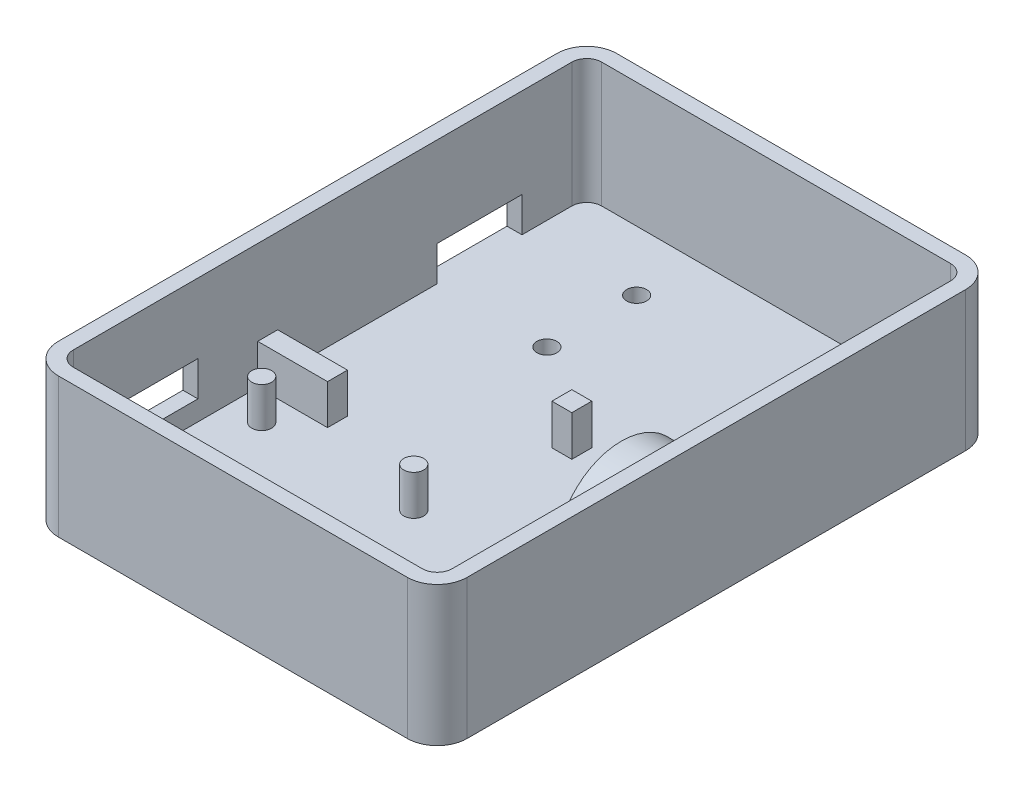
from build123d import *

# Parameters (mm, degrees)
SKETCH2_W            = 41
SKETCH2_H            = 56
BOSS_EXTRUDE1_DEPTH  = 14
FILLET1_R            = 3
SHELL1_T             = -1.5
SKETCH3_W            = 7
SKETCH3_H            = 2
SKETCH3_W_2          = 2
SKETCH3_H_2          = 5
BOSS_EXTRUDE3_DEPTH  = 4
SKETCH4_W            = 2
SKETCH4_H            = 2
BOSS_EXTRUDE4_DEPTH  = 4.052221169
SKETCH6_W            = 8
SKETCH6_H            = 3.5
CUT_EXTRUDE1_DEPTH   = 70.944620951
SKETCH7_R            = 1
BOSS_EXTRUDE5_DEPTH  = 4
SKETCH8_W            = 8.5
SKETCH8_H            = 3.5
CUT_EXTRUDE2_DEPTH   = 70.944620951
SKETCH12_R           = 6.5
BOSS_EXTRUDE7_DEPTH  = 3.5
SKETCH13_R           = 5.15
CUT_EXTRUDE5_DEPTH   = 3.5
SKETCH15_W           = 1.3
SKETCH15_H           = 3.704358433
BOSS_EXTRUDE8_DEPTH  = 3.5
SKETCH16_W           = 2.3
SKETCH16_H           = 1.398241718
BOSS_EXTRUDE9_DEPTH  = 3.5
SKETCH17_W           = 1.2
SKETCH17_H           = 5.421175269
BOSS_EXTRUDE10_DEPTH = 3.5
SKETCH18_W           = 2.4
SKETCH18_H           = 1.320829883
BOSS_EXTRUDE12_DEPTH = 3.5
SKETCH21_W           = 4
SKETCH21_H           = 3
CUT_EXTRUDE6_DEPTH   = 3.5
SKETCH22_R           = 1
CUT_EXTRUDE7_DEPTH   = 71.521273386
SKETCH28_R           = 1
CUT_EXTRUDE10_DEPTH  = 71.521273386


with BuildPart() as part:
    # Sketch2 → Boss-Extrude1 (new body)
    with BuildSketch(Plane(origin=(0, 0, 0), x_dir=(1, 0, 0), z_dir=(0, 1, 0))):
        with Locations((20.5, 28)):
            Rectangle(SKETCH2_W, SKETCH2_H)
    extrude(amount=BOSS_EXTRUDE1_DEPTH)

    # Fillet1
    fillet1_edges = [part.edges().sort_by_distance(p)[0] for p in [
        (0, 7, 0),
        (0, 7, -56),
        (41, 7, -56),
        (41, 7, 0),
    ]]
    fillet(fillet1_edges, radius=FILLET1_R)

    # Shell1
    shell1_openings = [part.faces().sort_by_distance(p)[0] for p in [
        (20.5, 14, -28),
    ]]
    offset(amount=SHELL1_T, openings=shell1_openings, kind=Kind.INTERSECTION)

    # Sketch3 → Boss-Extrude3 (add)
    with BuildSketch(Plane(origin=(0, 1.5, 0), x_dir=(1, 0, 0), z_dir=(0, 1, 0))):
        with Locations((5, 22.5)):
            Rectangle(SKETCH3_W, SKETCH3_H)
        with Locations((23.5, 4)):
            Rectangle(SKETCH3_W_2, SKETCH3_H_2)
    extrude(amount=BOSS_EXTRUDE3_DEPTH)

    # Sketch4 → Boss-Extrude4 (add)
    with BuildSketch(Plane(origin=(0, 1.5, 0), x_dir=(1, 0, 0), z_dir=(0, 1, 0))):
        with Locations((22.5, 32)):
            Rectangle(SKETCH4_W, SKETCH4_H)
    extrude(amount=BOSS_EXTRUDE4_DEPTH)

    # Sketch6 → Cut-Extrude1 (cut, through all)
    with BuildSketch(Plane(origin=(1.5, 0, 0), x_dir=(0, 0, -1), z_dir=(1, 0, 0))):
        with Locations((11.5, 5.25)):
            Rectangle(SKETCH6_W, SKETCH6_H)
    extrude(amount=-CUT_EXTRUDE1_DEPTH, mode=Mode.SUBTRACT)

    # Sketch7 → Boss-Extrude5 (add)
    with BuildSketch(Plane(origin=(0, 1.5, 0), x_dir=(1, 0, 0), z_dir=(0, 1, 0))):
        with Locations((4.75, 18.65)):
            Circle(SKETCH7_R)
        with Locations((20, 18.65)):
            Circle(SKETCH7_R)
        with Locations((4.75, 4.35)):
            Circle(SKETCH7_R)
        with Locations((20, 4.35)):
            Circle(SKETCH7_R)
    extrude(amount=BOSS_EXTRUDE5_DEPTH)

    # Sketch8 → Cut-Extrude2 (cut, through all)
    with BuildSketch(Plane(origin=(1.5, 0, 0), x_dir=(0, 0, -1), z_dir=(1, 0, 0))):
        with Locations((43.75, 3.25)):
            Rectangle(SKETCH8_W, SKETCH8_H)
    extrude(amount=-CUT_EXTRUDE2_DEPTH, mode=Mode.SUBTRACT)

    # Sketch12 → Boss-Extrude7 (add)
    with BuildSketch(Plane.ZY.offset(-39.5)):
        with Locations((-23.469922622, 6.6)):
            Circle(SKETCH12_R)
    extrude(amount=BOSS_EXTRUDE7_DEPTH)

    # Sketch13 → Cut-Extrude5 (cut)
    with BuildSketch(Plane.ZY.offset(-36)):
        with Locations((-23.469922622, 6.6)):
            Circle(SKETCH13_R)
    extrude(amount=-CUT_EXTRUDE5_DEPTH, mode=Mode.SUBTRACT)

    # Sketch15 → Boss-Extrude8 (add)
    with BuildSketch(Plane.ZY.offset(-39.5)):
        with Locations((-29.146876513, 3.352179217)):
            Rectangle(SKETCH15_W, SKETCH15_H)
    extrude(amount=BOSS_EXTRUDE8_DEPTH)

    # Sketch16 → Boss-Extrude9 (add)
    with BuildSketch(Plane.ZY.offset(-39.5)):
        with Locations((-28.646876513, 2.199120859)):
            Rectangle(SKETCH16_W, SKETCH16_H)
    extrude(amount=BOSS_EXTRUDE9_DEPTH)

    # Sketch17 → Boss-Extrude10 (add)
    with BuildSketch(Plane.ZY.offset(-39.5)):
        with Locations((-17.651553886, 4.210587635)):
            Rectangle(SKETCH17_W, SKETCH17_H)
    extrude(amount=BOSS_EXTRUDE10_DEPTH)

    # Sketch18 → Boss-Extrude12 (add)
    with BuildSketch(Plane.ZY.offset(-39.5)):
        with Locations((-18.251553886, 2.160414942)):
            Rectangle(SKETCH18_W, SKETCH18_H)
    extrude(amount=BOSS_EXTRUDE12_DEPTH)

    # Sketch21 → Cut-Extrude6 (cut)
    with BuildSketch(Plane.ZY.offset(-36)):
        with Locations((-28.400298424, 7.23482229)):
            Rectangle(SKETCH21_W, SKETCH21_H)
    extrude(amount=-CUT_EXTRUDE6_DEPTH, mode=Mode.SUBTRACT)

    # Sketch22 → Cut-Extrude7 (cut, through all)
    with BuildSketch(Plane(origin=(0, 1.5, 0), x_dir=(1, 0, 0), z_dir=(0, 1, 0))):
        with Locations((12.5, 39.5)):
            Circle(SKETCH22_R)
    extrude(amount=-CUT_EXTRUDE7_DEPTH, mode=Mode.SUBTRACT)

    # Sketch28 → Cut-Extrude10 (cut, through all)
    with BuildSketch(Plane(origin=(0, 1.5, 0), x_dir=(1, 0, 0), z_dir=(0, 1, 0))):
        with Locations((12.5, 48.5)):
            Circle(SKETCH28_R)
    extrude(amount=-CUT_EXTRUDE10_DEPTH, mode=Mode.SUBTRACT)


solid = part.part
